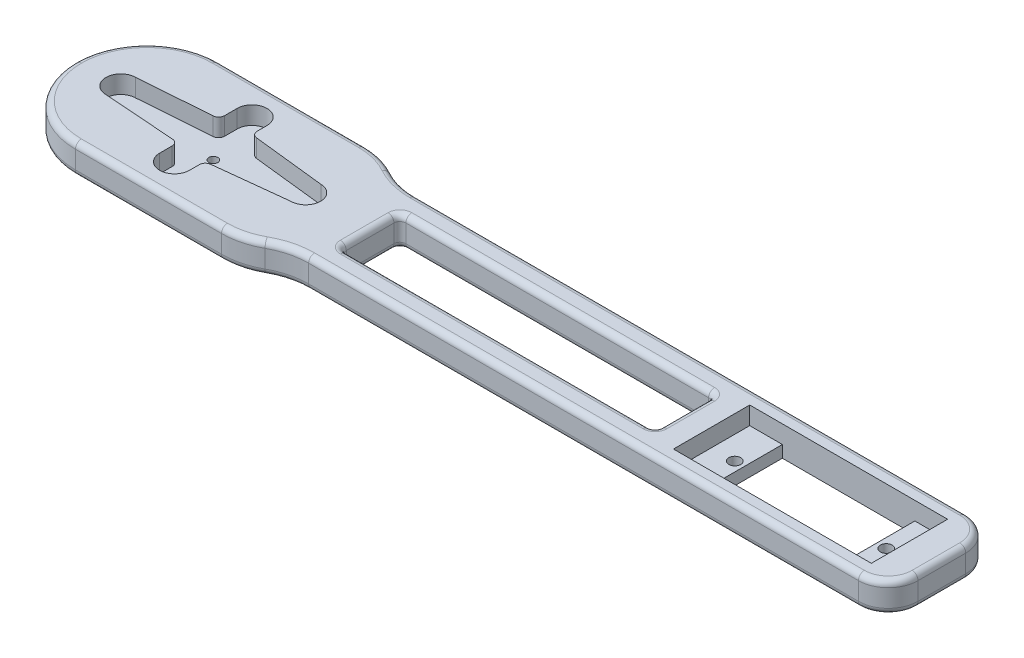
from build123d import *

# Parameters (mm, degrees)
BOSS_EXTRUDE1_DEPTH = 6
CUT_EXTRUDE2_START  = -1
CUT_EXTRUDE2_DEPTH  = 1
SKETCH17_R          = 0.75
CUT_EXTRUDE8_DEPTH  = 4
SKETCH18_R          = 0.75
CUT_EXTRUDE9_DEPTH  = 107.032849905
SKETCH19_W          = 33.2
SKETCH19_H          = 12.8
CUT_EXTRUDE10_DEPTH = 4
SKETCH20_R          = 1
SKETCH20_W          = 22.23131136
SKETCH20_H          = 12.8
CUT_EXTRUDE11_DEPTH = 106.957374727
CUT_EXTRUDE14_DEPTH = 107.084707941
CUT_EXTRUDE15_DEPTH = 101.853925106
FILLET1_R           = 5
CUT_EXTRUDE16_DEPTH = 10
FILLET2_R           = 12
FILLET3_R           = 12
FILLET4_R           = 12
FILLET5_R           = 12
FILLET6_R           = 1
FILLET7_R           = 1


# Read off the part's stored shape, not the designer's step: Cut-Extrude2
# Some blends are built 0.0001 mm under size
with BuildPart() as part:
    # Sketch1 → Boss-Extrude1 (new body)
    with BuildSketch(Plane(origin=(0, 0, 0), x_dir=(1, 0, 0), z_dir=(0, 1, 0))):
        with BuildLine():
            Line((0, 13.97), (47.625, 13.97))
            Line((47.625, 13.97), (47.625, 1.969341724))
            Line((47.625, 1.969341724), (47.625, -12.000658276))
            Line((47.625, -12.000658276), (0, -12.000658276))
            Line((0, -12.000658276), (-47.625, -12.000658276))
            Line((-47.625, -12.000658276), (-50.459972113, -12.000658276))
            ThreePointArc((-50.459972113, -12.000658276), (-102.034450626, 0.984670862), (-50.459972113, 13.97))
            Line((-50.459972113, 13.97), (-47.625, 13.97))
            Line((-47.625, 13.97), (0, 13.97))
        make_face()
    extrude(amount=BOSS_EXTRUDE1_DEPTH)

    # Cut-Extrude2 outline → Cut-Extrude2 (cut)
    with BuildSketch(Plane(origin=(0, 6, 0), x_dir=(1, 0, 0), z_dir=(0, 1, 0)).offset(CUT_EXTRUDE2_START)):
        with BuildLine():
            ThreePointArc((-50.459972113, 13.97), (-102.034450626, 0.984670862), (-50.459972113, -12.000658276))
            Line((-50.459972113, -12.000658276), (47.625, -12.000658276))
            Line((47.625, -12.000658276), (47.625, 13.97))
            Line((47.625, 13.97), (-50.459972113, 13.97))
        make_face()
    extrude(amount=CUT_EXTRUDE2_DEPTH, mode=Mode.SUBTRACT)

    # Sketch17 → Cut-Extrude8 (cut)
    with BuildSketch(Plane(origin=(0, 6, 0), x_dir=(1, 0, 0), z_dir=(0, 1, 0))):
        with BuildLine():
            Line((-59.083269409, 3.484499971), (-71.222931526, 4.833351317))
            ThreePointArc((-71.222931526, 4.833351317), (-71.857628018, 5.160313589), (-72.1125, 5.827235052))
            Line((-72.1125, 5.827235052), (-72.1125, 7.484670862))
            ThreePointArc((-72.1125, 7.484670862), (-74.6125, 9.984670862), (-77.1125, 7.484670862))
            Line((-77.1125, 7.484670862), (-77.1125, 5.377669348))
            ThreePointArc((-77.1125, 5.377669348), (-77.379740938, 4.697181172), (-78.038628314, 4.380401593))
            Line((-78.038628314, 4.380401593), (-90.132022217, 3.484594638))
            ThreePointArc((-90.132022217, 3.484594638), (-92.6125, 0.984670862), (-90.132022217, -1.515252913))
            Line((-90.132022217, -1.515252913), (-78.038628314, -2.411059869))
            ThreePointArc((-78.038628314, -2.411059869), (-77.379740938, -2.727839448), (-77.1125, -3.408327624))
            Line((-77.1125, -3.408327624), (-77.1125, -5.515329138))
            ThreePointArc((-77.1125, -5.515329138), (-74.6125, -8.015329138), (-72.1125, -5.515329138))
            Line((-72.1125, -5.515329138), (-72.1125, -3.857893328))
            ThreePointArc((-72.1125, -3.857893328), (-71.857628018, -3.190971865), (-71.222931526, -2.864009593))
            Line((-71.222931526, -2.864009593), (-59.083269409, -1.515158247))
            ThreePointArc((-59.083269409, -1.515158247), (-56.6125, 0.984670862), (-59.083269409, 3.484499971))
        make_face()
        with Locations(Location((-74.6125, 0.984670862, 0), (0, 0, 270))):
            Circle(SKETCH17_R, mode=Mode.SUBTRACT)
    extrude(amount=-CUT_EXTRUDE8_DEPTH, mode=Mode.SUBTRACT)

    # Sketch18 → Cut-Extrude9 (cut, through all)
    with BuildSketch(Plane(origin=(0, 5, 0), x_dir=(1, 0, 0), z_dir=(0, 1, 0))):
        with Locations(Location((-74.6125, 0.984670862, 0), (0, 0, 270))):
            Circle(SKETCH18_R)
    extrude(amount=-CUT_EXTRUDE9_DEPTH, mode=Mode.SUBTRACT)

    # Sketch19 → Cut-Extrude10 (cut)
    with BuildSketch(Plane(origin=(0, 6, 0), x_dir=(1, 0, 0), z_dir=(0, 1, 0))):
        with Locations((25.585, 0.984670862)):
            Rectangle(SKETCH19_W, SKETCH19_H)
    extrude(amount=-CUT_EXTRUDE10_DEPTH, mode=Mode.SUBTRACT)

    # Sketch20 → Cut-Extrude11 (cut, through all)
    with BuildSketch(Plane(origin=(0, 2, 0), x_dir=(1, 0, 0), z_dir=(0, 1, 0))):
        with Locations(Location((12.885, 0.984670862, 0), (0, 0, 270))):
            Circle(SKETCH20_R)
        with Locations(Location((38.285, 0.984670862, 0), (0, 0, 270))):
            Circle(SKETCH20_R)
        with Locations((25.575892078, 0.984670862)):
            Rectangle(SKETCH20_W, SKETCH20_H)
    extrude(amount=-CUT_EXTRUDE11_DEPTH, mode=Mode.SUBTRACT)

    # Sketch21 → Cut-Extrude14 (cut, through all)
    with BuildSketch(Plane(origin=(0, 6, 0), x_dir=(1, 0, 0), z_dir=(0, 1, 0))):
        with BuildLine():
            Line((-53.303512895, 9.984670862), (47.625, 9.984670862))
            Line((47.625, 9.984670862), (47.625, 13.97))
            Line((47.625, 13.97), (-50.459972113, 13.97))
            ThreePointArc((-50.459972113, 13.97), (-102.034450626, 0.984670862), (-50.459972113, -12.000658276))
            Line((-50.459972113, -12.000658276), (47.625, -12.000658276))
            Line((47.625, -12.000658276), (47.625, -8.015329138))
            Line((47.625, -8.015329138), (-53.303512895, -8.015329138))
            ThreePointArc((-53.303512895, -8.015329138), (-97.74414351, 0.984670862), (-53.303512895, 9.984670862))
        make_face()
    extrude(amount=-CUT_EXTRUDE14_DEPTH, mode=Mode.SUBTRACT)

    # Sketch23 → Cut-Extrude15 (cut, through all)
    with BuildSketch(Plane(origin=(0, 6, 0), x_dir=(1, 0, 0), z_dir=(0, 1, 0))):
        with BuildLine():
            Line((-48.303512895, 4.984670862), (-48.303512895, -3.015329138))
            ThreePointArc((-48.303512895, -3.015329138), (-48.010619676, -3.722435919), (-47.303512895, -4.015329138))
            Line((-47.303512895, -4.015329138), (3.485, -4.015329138))
            ThreePointArc((3.485, -4.015329138), (4.192106781, -3.722435919), (4.485, -3.015329138))
            Line((4.485, -3.015329138), (4.485, 4.984670862))
            ThreePointArc((4.485, 4.984670862), (4.192106781, 5.691777643), (3.485, 5.984670862))
            Line((3.485, 5.984670862), (-47.303512895, 5.984670862))
            ThreePointArc((-47.303512895, 5.984670862), (-48.010619676, 5.691777643), (-48.303512895, 4.984670862))
        make_face()
    extrude(amount=-CUT_EXTRUDE15_DEPTH, mode=Mode.SUBTRACT)

    # Fillet1
    fillet1_edges = [part.edges().sort_by_distance(p)[0] for p in [
        (47.625, 2.5, 8.015329138),
        (47.625, 2.5, -9.984670862),
    ]]
    fillet(fillet1_edges, radius=FILLET1_R)

    # Sketch25 → Cut-Extrude16 (cut)
    with BuildSketch(Plane(origin=(0, 5, 0), x_dir=(1, 0, 0), z_dir=(0, 1, 0))):
        with BuildLine():
            Line((-94.388063999, -11.015329138), (-54.836936001, -11.015329138))
            ThreePointArc((-54.836936001, -11.015329138), (-74.6125, -22.146972648), (-94.388063999, -11.015329138))
        make_face()
        with BuildLine():
            Line((-94.388063999, 12.984670862), (-54.836936001, 12.984670862))
            ThreePointArc((-54.836936001, 12.984670862), (-74.6125, 24.116314372), (-94.388063999, 12.984670862))
        make_face()
    extrude(amount=-CUT_EXTRUDE16_DEPTH, mode=Mode.SUBTRACT)

    # Fillet2
    # the kernel refuses this fillet: 12 mm, written as the material it takes off along each edge
    with BuildSketch(Plane(origin=(-54.836936001, 21.009577066, -12.984670862), x_dir=(-1, 0, 0), z_dir=(0, -1, 0))) as fillet2_piece_1:
        with BuildLine():
            CenterArc((6.403830826, -12), FILLET2_R, 90, 41.409622109)
            Line((-1.533423107, -3), (-1.692168186, -2.82))
            ThreePointArc((-1.692168186, -2.82), (-1.035105589, -1.362812794), (-0.20517934, 0.124504772))
            Line((-0.20517934, 0.124504772), (0, 0.24))
            Line((0, 0.24), (6.403830826, 0.24))
            Line((6.403830826, 0.24), (6.403830826, 0))
        make_face()
    extrude(amount=37.019154131, mode=Mode.SUBTRACT)

    # Fillet3
    fillet3_edges = [part.edges().sort_by_distance(p)[0] for p in [
        (-94.388063999, 2.5, 11.015329138),
        (-94.388063999, 2.5, -12.984670862),
    ]]
    fillet(fillet3_edges, radius=FILLET3_R - 0.0001)  # a hair under: the kernel refuses the full size

    # Fillet4
    # the kernel refuses this fillet: 12 mm, written as the material it takes off along each edge
    with BuildSketch(Plane(origin=(-54.836936001, 21.009577066, 11.015329138), x_dir=(-1, 0, 0), z_dir=(0, -1, 0))) as fillet4_piece_1:
        with BuildLine():
            CenterArc((6.403830826, 12), FILLET4_R, 228.590377891, 41.409622109)
            Line((-1.533423107, 3), (-1.692168186, 2.82))
            ThreePointArc((-1.692168186, 2.82), (-1.035105589, 1.362812794), (-0.20517934, -0.124504772))
            Line((-0.20517934, -0.124504772), (0, -0.24))
            Line((0, -0.24), (6.403830826, -0.24))
            Line((6.403830826, -0.24), (6.403830826, 0))
        make_face()
    extrude(amount=37.019154131, mode=Mode.SUBTRACT)

    # Fillet5
    fillet5_edges = [part.edges().sort_by_distance(p)[0] for p in [
        (-53.303512895, 2.5, -9.984670862),
        (-53.303512895, 2.5, 8.015329138),
    ]]
    fillet(fillet5_edges, radius=FILLET5_R)

    # Fillet6
    fillet6_edges = [part.edges().sort_by_distance(p)[0] for p in [
        (-3.498408395, 5, 8.015329138),
        (-3.498408395, 0, 8.015329138),
        (47.625, 5, -0.984670862),
        (46.160533906, 5, -8.520204768),
        (46.160533906, 5, 6.550863044),
        (47.625, 0, -0.984670862),
        (46.160533906, 0, -8.520204768),
        (46.160533906, 0, 6.550863044),
        (-58.240766828, 0, -12.603620901),
        (-73.492505169, 5, -12.984670862),
        (-94.22941606, 5, -9.470019638),
        (-94.22941606, 5, 7.500677914),
        (-73.492505169, 0, -12.984670862),
        (-94.22941606, 0, -9.470019638),
        (-94.22941606, 0, 7.500677914),
        (-73.492505169, 0, 11.015329138),
        (-73.492505169, 5, 11.015329138),
        (-58.240766828, 5, 10.634279177),
        (-58.240766828, 0, 10.634279177),
        (-3.498408395, 5, -9.984670862),
        (-3.498408395, 0, -9.984670862),
        (-58.240766828, 5, -12.603620901),
        (-52.621816789, 5, 8.396379099),
        (-52.621816789, 0, 8.396379099),
        (-52.621816789, 5, -10.365720823),
        (-52.621816789, 0, -10.365720823),
    ]]
    fillet(fillet6_edges, radius=FILLET6_R)

    # Fillet7
    fillet7_edges = [part.edges().sort_by_distance(p)[0] for p in [
        (-48.303512895, 5, -0.984670862),
        (-48.010619676, 5, 3.722435919),
        (-21.909256447, 5, 4.015329138),
        (4.192106781, 5, 3.722435919),
        (4.485, 5, -0.984670862),
        (4.192106781, 5, -5.691777643),
        (-21.909256447, 5, -5.984670862),
        (-48.010619676, 5, -5.691777643),
        (-48.010619676, 0, -5.691777643),
        (-21.909256447, 0, -5.984670862),
        (4.192106781, 0, -5.691777643),
        (4.485, 0, -0.984670862),
        (4.192106781, 0, 3.722435919),
        (-21.909256447, 0, 4.015329138),
        (-48.010619676, 0, 3.722435919),
        (-48.303512895, 0, -0.984670862),
    ]]
    fillet(fillet7_edges, radius=FILLET7_R)


solid = part.part
